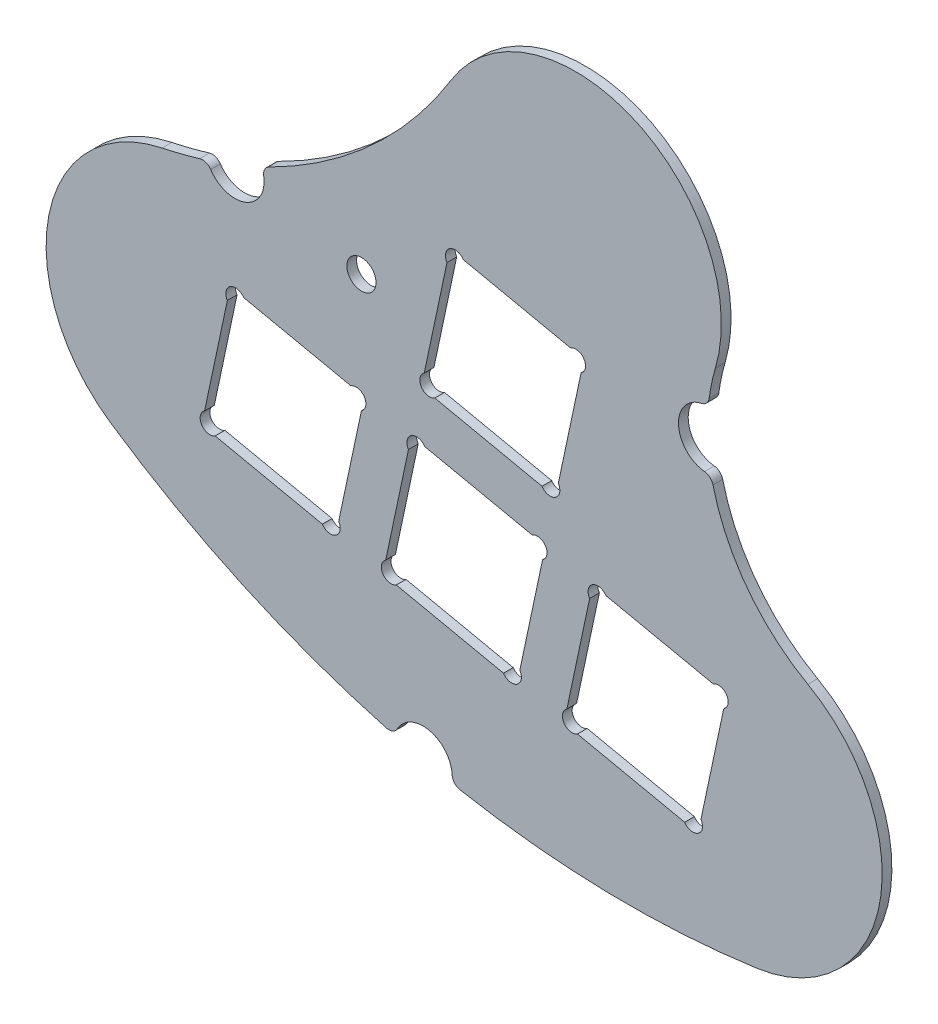
from build123d import *
from build123d.topology import SkipClean

# Parameters (mm, degrees)
BOSS_EXTRUDE1_DEPTH   = 1
SKETCH8_3_R           = 3
CUT_EXTRUDE1_DEPTH    = 182.285837692
CUT_EXTRUDE2_DEPTH    = 182.285837692
SKETCH10_W            = 14.1
SKETCH10_H            = 14.1
CUT_EXTRUDE3_DEPTH    = 185.637780297
F_3_0MM_DOWEL_HOLE1_D = 3
FILLET1_R             = 1


with BuildPart() as part:
    # Sketch8 → Boss-Extrude1 (new body)
    with BuildSketch(Plane.XY):
        with BuildLine():
            ThreePointArc((73.852303576, 63.794594289), (73.863549821, 63.839319131), (73.875482243, 63.883865813))
            ThreePointArc((73.875482243, 63.883865813), (76.767270103, 63.085390407), (79.729789892, 62.612657392))
            ThreePointArc((79.729789892, 62.612657392), (79.717062502, 62.538833177), (79.702495752, 62.465349771))
            ThreePointArc((79.702495752, 62.465349771), (95.373691885, 60.7573177), (111.111302129, 61.669121188))
            ThreePointArc((111.111302129, 61.669121188), (123.74416397, 73.75113123), (116.356165737, 89.593531525))
            ThreePointArc((116.356165737, 89.593531525), (107.510169126, 99.635128091), (106.844308874, 113.000828513))
            ThreePointArc((106.844308874, 113.000828513), (98.551785503, 130.943955248), (79.67265081, 125.087333856))
            ThreePointArc((79.67265081, 125.087333856), (66.957923375, 111.551078569), (49.923987164, 104.152462611))
            ThreePointArc((49.923987164, 104.152462611), (38.279791522, 92.371702096), (44.581782069, 77.053134095))
            ThreePointArc((44.581782069, 77.053134095), (58.651333394, 69.17496271), (73.852303576, 63.794594289))
        make_face()
        with BuildLine():
            ThreePointArc((56.72077423, 104.000844147), (56.721683918, 104.00117089), (56.7225936, 104.001497652))
            ThreePointArc((56.7225936, 104.001497652), (56.755397532, 103.992206145), (56.788325126, 103.983362865))
            ThreePointArc((56.788325126, 103.983362865), (56.754559843, 103.992142785), (56.72077423, 104.000844147))
        make_face(mode=Mode.SUBTRACT)
        with BuildLine():
            ThreePointArc((109.376341775, 92.015545509), (109.37615287, 92.017539878), (109.375963817, 92.019534234))
            ThreePointArc((109.375963817, 92.019534234), (109.377797318, 92.017499849), (109.379631064, 92.015465685))
            ThreePointArc((109.379631064, 92.015465685), (109.377986421, 92.015505684), (109.376341775, 92.015545509))
        make_face(mode=Mode.SUBTRACT)
        with BuildLine():
            ThreePointArc((103.532400156, 106.396636288), (103.543227812, 106.407709628), (103.554044399, 106.418793781))
            ThreePointArc((103.554044399, 106.418793781), (103.552293137, 106.396310438), (103.550744757, 106.373812212))
            ThreePointArc((103.550744757, 106.373812212), (103.541575551, 106.385226737), (103.532400156, 106.396636288))
        make_face(mode=Mode.SUBTRACT)
        with BuildLine():
            ThreePointArc((104.021801646, 107.681154775), (104.021865069, 107.684582448), (104.021929019, 107.688010111))
            ThreePointArc((104.021929019, 107.688010111), (104.063142491, 107.7381429), (104.104138674, 107.788453533))
            ThreePointArc((104.104138674, 107.788453533), (104.062244422, 107.735361058), (104.021801646, 107.681154775))
        make_face(mode=Mode.SUBTRACT)
    extrude(amount=BOSS_EXTRUDE1_DEPTH)

    # Sketch8<3> → Cut-Extrude1 (cut, through all)
    with SkipClean():  # the faces are left unmerged after this step: merging them gives an invalid solid
        with BuildSketch(Plane.XY):
            with Locations((106.04559389, 106.21341333)):
                Circle(SKETCH8_3_R)
            with Locations((76.767270103, 63.085390407)):
                Circle(SKETCH8_3_R)
            with Locations((57.420286528, 106.402169345)):
                Circle(SKETCH8_3_R)
        extrude(amount=CUT_EXTRUDE1_DEPTH, mode=Mode.SUBTRACT)

    # Sketch14 → Cut-Extrude2 (cut, through all)
    with SkipClean():  # the faces are left unmerged after this step: merging them gives an invalid solid
        with BuildSketch(Plane.XY):
            with BuildLine():
                Line((54.297852906, 82.909160119), (55.387130976, 81.231818983))
                ThreePointArc((55.387130976, 81.231818983), (54.003821373, 81.525850516), (54.297852906, 82.909160119))
            make_face()
            with BuildLine():
                Line((56.641344681, 93.934422083), (58.318685817, 95.023700153))
                ThreePointArc((58.318685817, 95.023700153), (56.935376214, 95.317731686), (56.641344681, 93.934422083))
            make_face()
            with BuildLine():
                Line((69.343947781, 92.680208378), (70.433225851, 91.002867242))
                ThreePointArc((70.433225851, 91.002867242), (70.727257384, 92.386176845), (69.343947781, 92.680208378))
            make_face()
            with BuildLine():
                Line((68.089734077, 79.977605278), (66.412392941, 78.888327208))
                ThreePointArc((66.412392941, 78.888327208), (67.795702544, 78.594295675), (68.089734077, 79.977605278))
            make_face()
            with BuildLine():
                Line((75.275056475, 89.973704373), (76.952397611, 91.062982443))
                ThreePointArc((76.952397611, 91.062982443), (75.569088008, 91.357013976), (75.275056475, 89.973704373))
            make_face()
            with BuildLine():
                Line((72.9315647, 78.948442409), (74.02084277, 77.271101273))
                ThreePointArc((74.02084277, 77.271101273), (72.637533167, 77.565132806), (72.9315647, 78.948442409))
            make_face()
            with BuildLine():
                Line((85.046104735, 74.927609498), (86.723445871, 76.016887568))
                ThreePointArc((86.723445871, 76.016887568), (86.429414338, 74.633577965), (85.046104735, 74.927609498))
            make_face()
            with BuildLine():
                Line((89.066937645, 87.042149532), (87.977659575, 88.719490668))
                ThreePointArc((87.977659575, 88.719490668), (89.360969178, 88.425459135), (89.066937645, 87.042149532))
            make_face()
            with BuildLine():
                Line((89.006822445, 93.561321292), (90.684163581, 94.650599362))
                ThreePointArc((90.684163581, 94.650599362), (90.390132048, 93.267289759), (89.006822445, 93.561321292))
            make_face()
            with BuildLine():
                Line((76.89228241, 97.582154203), (77.981560481, 95.904813067))
                ThreePointArc((77.981560481, 95.904813067), (76.598250878, 96.1988446), (76.89228241, 97.582154203))
            make_face()
            with BuildLine():
                Line((91.938377285, 107.353202462), (93.027655356, 105.675861326))
                ThreePointArc((93.027655356, 105.675861326), (93.321686888, 107.059170929), (91.938377285, 107.353202462))
            make_face()
            with BuildLine():
                Line((79.235774185, 108.607416167), (80.913115321, 109.696694237))
                ThreePointArc((80.913115321, 109.696694237), (79.529805718, 109.99072577), (79.235774185, 108.607416167))
            make_face()
            with BuildLine():
                Line((93.908768269, 86.012986663), (95.586109405, 87.102264733))
                ThreePointArc((95.586109405, 87.102264733), (94.202799802, 87.396296266), (93.908768269, 86.012986663))
            make_face()
            with BuildLine():
                Line((91.565276494, 74.987724698), (92.654554564, 73.310383563))
                ThreePointArc((92.654554564, 73.310383563), (91.271244961, 73.604415095), (91.565276494, 74.987724698))
            make_face()
            with BuildLine():
                Line((103.679816529, 70.966891788), (105.357157665, 72.056169858))
                ThreePointArc((105.357157665, 72.056169858), (105.063126132, 70.672860255), (103.679816529, 70.966891788))
            make_face()
            with BuildLine():
                Line((106.611371369, 84.758772958), (107.700649439, 83.081431822))
                ThreePointArc((107.700649439, 83.081431822), (107.994680972, 84.464741425), (106.611371369, 84.758772958))
            make_face()
        extrude(amount=CUT_EXTRUDE2_DEPTH, mode=Mode.SUBTRACT)

    # Sketch10 → Cut-Extrude3 (cut, through all)
    with SkipClean():  # the faces are left unmerged after this step: merging them gives an invalid solid
        with BuildSketch(Plane(origin=(-22.098060608, 19.345391025, 0), x_dir=(0.9781476007338056, -0.2079116908177598, 0), z_dir=(0, 0, 1))):
            with Locations((68.560828803, 83.69413822)):
                Rectangle(SKETCH10_W, SKETCH10_H)
            with Locations((87.610828803, 83.69413822)):
                Rectangle(SKETCH10_W, SKETCH10_H)
            with Locations((106.660828803, 83.69413822)):
                Rectangle(SKETCH10_W, SKETCH10_H)
            with Locations((87.610828803, 102.74413822)):
                Rectangle(SKETCH10_W, SKETCH10_H)
        extrude(amount=CUT_EXTRUDE3_DEPTH, mode=Mode.SUBTRACT)

    # Ø3.0mm Dowel Hole1 (through all)
    with Locations(Plane.XY.offset(1)):
        with Locations((70.435309654, 103.157249982)):
            Hole(F_3_0MM_DOWEL_HOLE1_D / 2)

    # Fillet1
    fillet1_edges = [part.edges().sort_by_distance(p)[0] for p in [
        (79.702495752, 62.465349771, 0.5),
        (73.852303576, 63.794594289, 0.5),
        (106.42311517, 103.237261841, 0.5),
        (106.111211206, 109.212695638, 0.5),
        (54.596217873, 105.389926178, 0.5),
        (60.17229201, 107.596516793, 0.5),
    ]]
    fillet(fillet1_edges, radius=FILLET1_R)


solid = part.part
